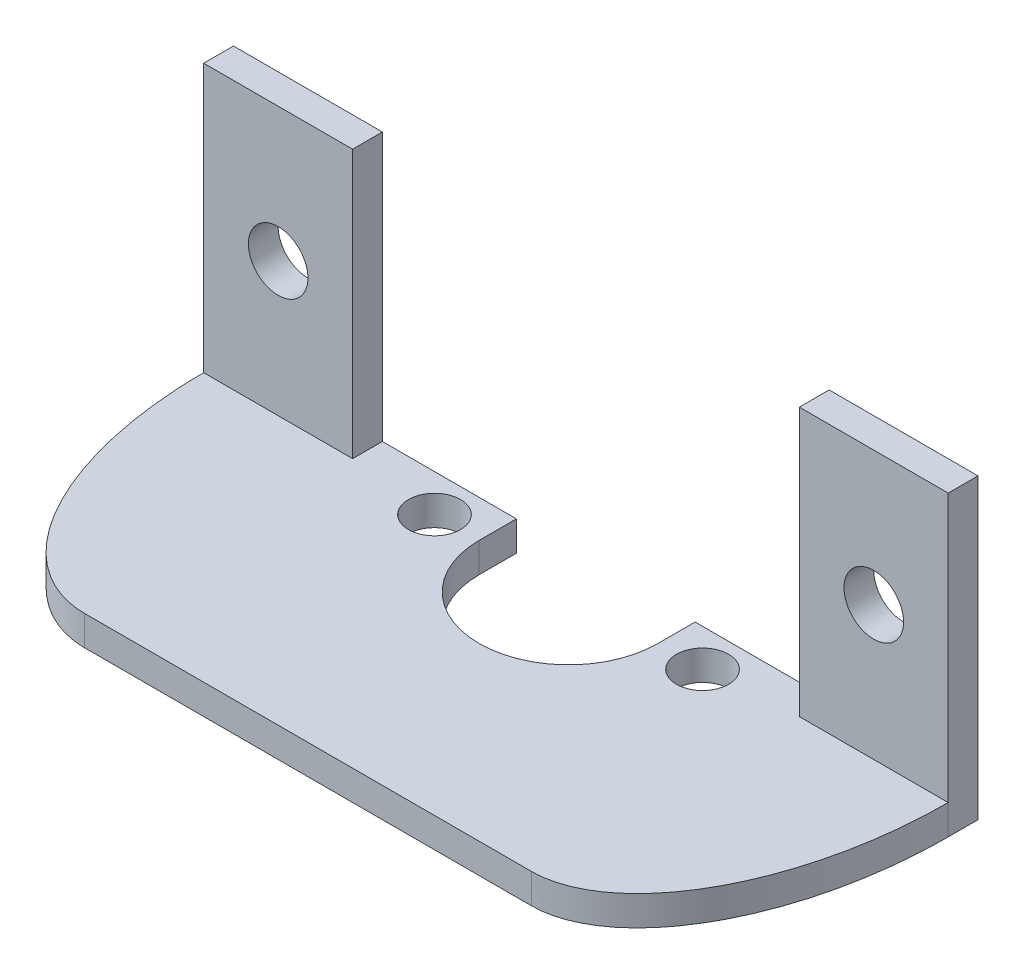
from build123d import *

# Parameters (mm, degrees)
SKETCH1_W           = 50
SKETCH1_H           = 20
BOSS_EXTRUDE1_DEPTH = 2
SKETCH2_W           = 10
SKETCH2_H           = 2
BOSS_EXTRUDE2_DEPTH = 18
FILLET1_SIZE        = 10
FILLET1_SIZE_2      = 18
FILLET2_SIZE        = 18
FILLET2_SIZE_2      = 10
CUT_EXTRUDE1_DEPTH  = 33.388269589
SKETCH5_R           = 1.75
CUT_EXTRUDE2_DEPTH  = 33.388269589
SKETCH6_R           = 2
CUT_EXTRUDE3_DEPTH  = 37.728735461


with BuildPart() as part:
    # Sketch1 → Boss-Extrude1 (new body)
    with BuildSketch(Plane(origin=(0, 0, 0), x_dir=(1, 0, 0), z_dir=(0, 1, 0))):
        Rectangle(SKETCH1_W, SKETCH1_H)
    extrude(amount=BOSS_EXTRUDE1_DEPTH)

    # Sketch2 → Boss-Extrude2 (add)
    with BuildSketch(Plane(origin=(0, 2, 0), x_dir=(1, 0, 0), z_dir=(0, 1, 0))):
        with Locations((-20, 9)):
            Rectangle(SKETCH2_W, SKETCH2_H)
        with Locations((20, 9)):
            Rectangle(SKETCH2_W, SKETCH2_H)
    extrude(amount=BOSS_EXTRUDE2_DEPTH)

    # Fillet1
    # an asymmetric fillet: 18, 10 mm, written as the material it takes off along each edge
    with BuildSketch(Plane(origin=(-25, -45, 10), x_dir=(1, 0, 0), z_dir=(0, 1, 0))) as fillet1_piece_1:
        with BuildLine():
            Bezier((FILLET1_SIZE, 0), (0, 0), (0, FILLET1_SIZE_2), weights=[1, 0.707106781, 1])
            Line((0, FILLET1_SIZE_2), (0, 0))
            Line((0, 0), (FILLET1_SIZE, 0))
        make_face()
    extrude(amount=92, mode=Mode.SUBTRACT)

    # Fillet2
    # an asymmetric fillet: 18, 10 mm, written as the material it takes off along each edge
    with BuildSketch(Plane(origin=(25, -45, 10), x_dir=(0, 0, -1), z_dir=(0, 1, 0))) as fillet2_piece_1:
        with BuildLine():
            Bezier((FILLET2_SIZE, 0), (0, 0), (0, FILLET2_SIZE_2), weights=[1, 0.707106781, 1])
            Line((0, FILLET2_SIZE_2), (0, 0))
            Line((0, 0), (FILLET2_SIZE, 0))
        make_face()
    extrude(amount=92, mode=Mode.SUBTRACT)

    # Sketch4 → Cut-Extrude1 (cut, through all)
    with BuildSketch(Plane(origin=(0, 2, 0), x_dir=(1, 0, 0), z_dir=(0, 1, 0))):
        with BuildLine():
            Line((-6, 7.5), (-6, 10))
            Line((-6, 10), (6, 10))
            Line((6, 10), (6, 7.5))
            ThreePointArc((6, 7.5), (0, 1.5), (-6, 7.5))
        make_face()
    extrude(amount=-CUT_EXTRUDE1_DEPTH, mode=Mode.SUBTRACT)

    # Sketch5 → Cut-Extrude2 (cut, through all)
    with BuildSketch(Plane(origin=(0, 2, 0), x_dir=(1, 0, 0), z_dir=(0, 1, 0))):
        with Locations(Location((-9, 7.5, 0), (0, 0, 270))):
            Circle(SKETCH5_R)
        with Locations(Location((9, 7.5, 0), (0, 0, 270))):
            Circle(SKETCH5_R)
    extrude(amount=-CUT_EXTRUDE2_DEPTH, mode=Mode.SUBTRACT)

    # Sketch6 → Cut-Extrude3 (cut, through all)
    with BuildSketch(Plane.XY.offset(-8)):
        with Locations((20, 11)):
            Circle(SKETCH6_R)
        with Locations((-20, 11)):
            Circle(SKETCH6_R)
    extrude(amount=-CUT_EXTRUDE3_DEPTH, mode=Mode.SUBTRACT)


solid = part.part
